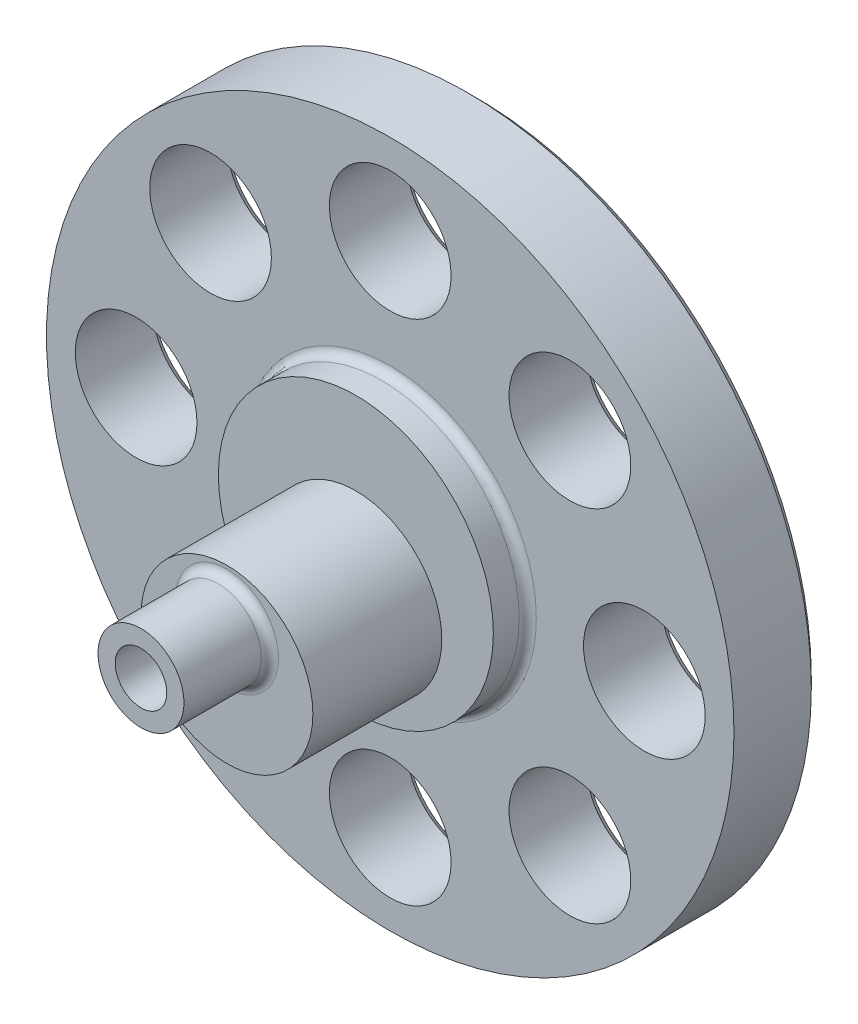
from build123d import *

# Parameters (mm, degrees)
SKETCH1_R           = 20
SKETCH1_R_2         = 3.54
BOSS_EXTRUDE1_DEPTH = 5
SKETCH2_R           = 8
BOSS_EXTRUDE2_DEPTH = 2
SKETCH3_R           = 6.5
CUT_EXTRUDE1_DEPTH  = 6
SKETCH4_R           = 5
BOSS_EXTRUDE3_DEPTH = 7.5
SKETCH5_R           = 2.5
BOSS_EXTRUDE4_DEPTH = 5
FILLET1_R           = 0.5
FILLET2_R           = 0.5
CHAMFER1_SIZE       = 0.5
SKETCH7_R           = 1.5
CUT_EXTRUDE2_DEPTH  = 15


with BuildPart() as part:
    # Sketch1 → Boss-Extrude1 (new body)
    with BuildSketch(Plane.XY):
        Circle(SKETCH1_R)
        with Locations((-14.783956386, 0)):
            Circle(SKETCH1_R_2, mode=Mode.SUBTRACT)
        with Locations((-10.453835814, -10.453835814)):
            Circle(SKETCH1_R_2, mode=Mode.SUBTRACT)
        with Locations((0, -14.783956386)):
            Circle(SKETCH1_R_2, mode=Mode.SUBTRACT)
        with Locations((10.453835814, -10.453835814)):
            Circle(SKETCH1_R_2, mode=Mode.SUBTRACT)
        with Locations((14.783956386, 0)):
            Circle(SKETCH1_R_2, mode=Mode.SUBTRACT)
        with Locations((10.453835814, 10.453835814)):
            Circle(SKETCH1_R_2, mode=Mode.SUBTRACT)
        with Locations((0, 14.783956386)):
            Circle(SKETCH1_R_2, mode=Mode.SUBTRACT)
        with Locations((-10.453835814, 10.453835814)):
            Circle(SKETCH1_R_2, mode=Mode.SUBTRACT)
    extrude(amount=BOSS_EXTRUDE1_DEPTH)

    # Sketch2 → Boss-Extrude2 (add)
    with BuildSketch(Plane.XY.offset(5)):
        Circle(SKETCH2_R)
    extrude(amount=BOSS_EXTRUDE2_DEPTH)

    # Sketch3 → Cut-Extrude1 (cut)
    with BuildSketch(Plane(origin=(0, 0, 0), x_dir=(-1, 0, 0), z_dir=(0, 0, -1))):
        Circle(SKETCH3_R)
    extrude(amount=-CUT_EXTRUDE1_DEPTH, mode=Mode.SUBTRACT)

    # Sketch4 → Boss-Extrude3 (add)
    with BuildSketch(Plane.XY.offset(7)):
        with Locations((0, -1.812)):
            Circle(SKETCH4_R)
    extrude(amount=BOSS_EXTRUDE3_DEPTH)

    # Sketch5 → Boss-Extrude4 (add)
    with BuildSketch(Plane.XY.offset(14.5)):
        Circle(SKETCH5_R)
    extrude(amount=BOSS_EXTRUDE4_DEPTH)

    # Fillet1
    fillet1_edges = [part.edges().sort_by_distance(p)[0] for p in [
        (-8, 0, 5),
    ]]
    fillet(fillet1_edges, radius=FILLET1_R)

    # Fillet2
    fillet2_edges = [part.edges().sort_by_distance(p)[0] for p in [
        (-2.5, 0, 14.5),
    ]]
    fillet(fillet2_edges, radius=FILLET2_R)

    # Chamfer1
    chamfer1_edges = [part.edges().sort_by_distance(p)[0] for p in [
        (-13.993835814, 10.453835814, 0),
        (-3.54, 14.783956386, 0),
        (6.913835814, 10.453835814, 0),
        (11.243956386, 0, 0),
        (6.913835814, -10.453835814, 0),
        (-3.54, -14.783956386, 0),
        (-13.993835814, -10.453835814, 0),
        (-18.323956386, 0, 0),
        (-20, 0, 0),
        (6.5, 0, 0),
    ]]
    chamfer(chamfer1_edges, length=CHAMFER1_SIZE)

    # Sketch7 → Cut-Extrude2 (cut)
    with BuildSketch(Plane.XY.offset(19.5)):
        Circle(SKETCH7_R)
    extrude(amount=-CUT_EXTRUDE2_DEPTH, mode=Mode.SUBTRACT)


solid = part.part
